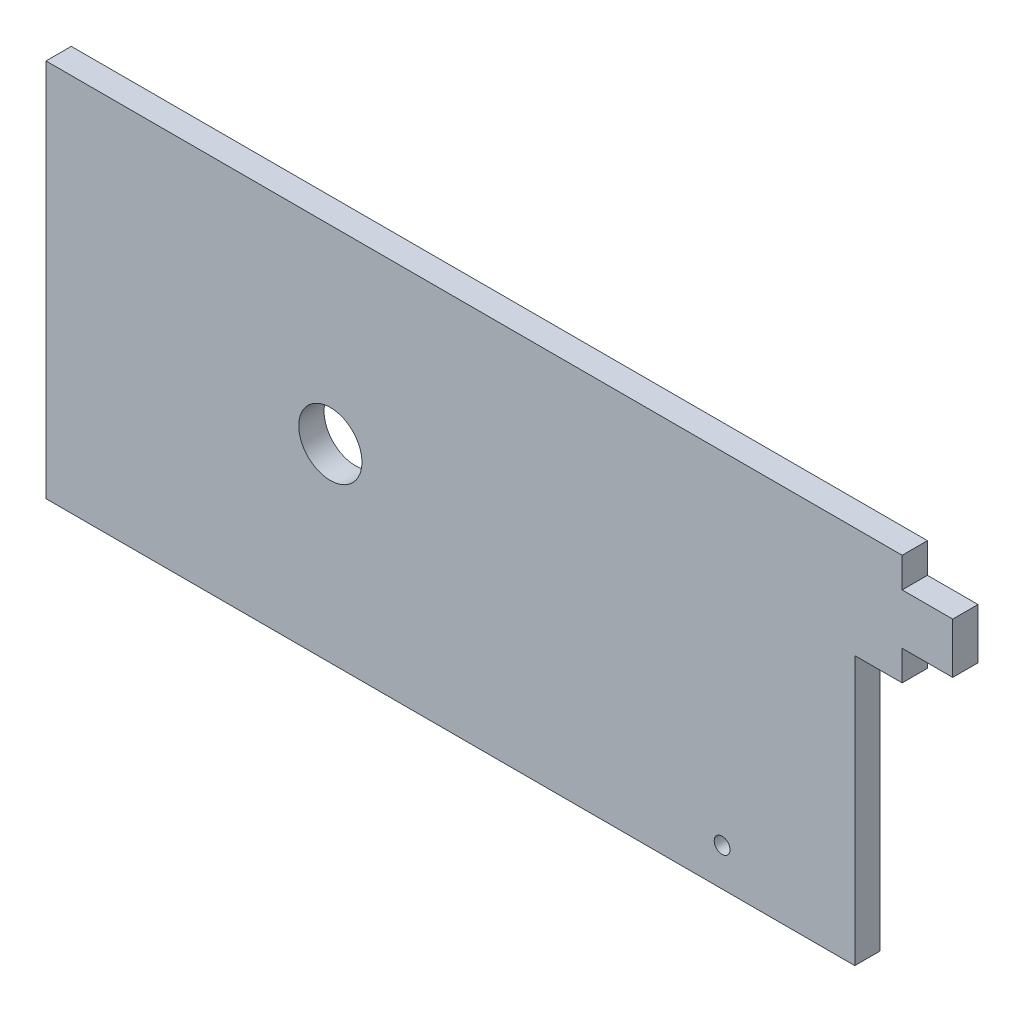
from build123d import *

# Parameters (mm, degrees)
SKETCH1_R           = 5
SKETCH1_R_2         = 1.25
BOSS_EXTRUDE1_DEPTH = 4


with BuildPart() as part:
    # Sketch1 → Boss-Extrude1 (new body)
    with BuildSketch(Plane.XY):
        Polygon((47, 30), (54.5, 30), (54.5, 25.25), (62.5, 25.25), (62.5, 17.25), (54.5, 17.25), (54.5, 12.5), (47, 12.5), (47, -30), (-81, -30), (-81, 30), align=None)
        with Locations((-36, 0)):
            Circle(SKETCH1_R, mode=Mode.SUBTRACT)
        with Locations((26, -24)):
            Circle(SKETCH1_R_2, mode=Mode.SUBTRACT)
    extrude(amount=BOSS_EXTRUDE1_DEPTH)


solid = part.part
